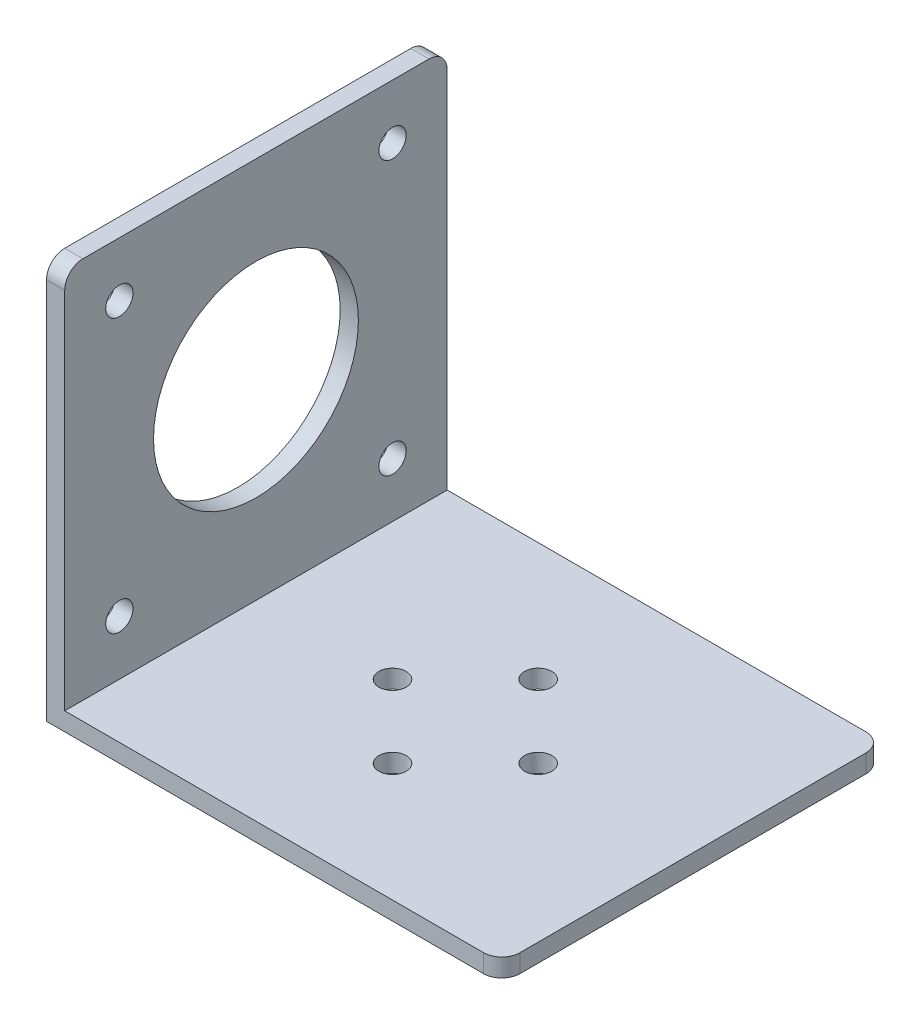
from build123d import *

# Parameters (mm, degrees)
SKETCH_1_W      = 50
SKETCH_1_H      = 42
SKETCH_1_R      = 1.5
EXTRUDE_2_DEPTH = 2
SKETCH_2_W      = 42
SKETCH_2_H      = 42
SKETCH_2_R      = 1.5
SKETCH_2_R_2    = 11.25
EXTRUDE_3_DEPTH = 2
FILLET_1_R      = 2
FILLET_2_R      = 2
FILLET_3_R      = 2


with BuildPart() as part:
    # 草图1 → 凸台-拉伸2 (new body)
    with BuildSketch(Plane(origin=(0, 0, 0), x_dir=(1, 0, 0), z_dir=(0, 1, 0))):
        Rectangle(SKETCH_1_W, SKETCH_1_H)
        with Locations((8, 0)):
            Circle(SKETCH_1_R, mode=Mode.SUBTRACT)
        with Locations((0, 8)):
            Circle(SKETCH_1_R, mode=Mode.SUBTRACT)
        with Locations((-8, 0)):
            Circle(SKETCH_1_R, mode=Mode.SUBTRACT)
        with Locations((0, -8)):
            Circle(SKETCH_1_R, mode=Mode.SUBTRACT)
    extrude(amount=EXTRUDE_2_DEPTH)

    # 草图2 → 凸台-拉伸3 (add)
    with BuildSketch(Plane.ZY.offset(25)):
        with Locations((0, 23)):
            Rectangle(SKETCH_2_W, SKETCH_2_H)
        with Locations((15, 38)):
            Circle(SKETCH_2_R, mode=Mode.SUBTRACT)
        with Locations((15, 8)):
            Circle(SKETCH_2_R, mode=Mode.SUBTRACT)
        with Locations((-15, 8)):
            Circle(SKETCH_2_R, mode=Mode.SUBTRACT)
        with Locations((-15, 38)):
            Circle(SKETCH_2_R, mode=Mode.SUBTRACT)
        with Locations((0, 23)):
            Circle(SKETCH_2_R_2, mode=Mode.SUBTRACT)
    extrude(amount=-EXTRUDE_3_DEPTH)

    # 圆角1
    fillet_1_edges = [part.edges().sort_by_distance(p)[0] for p in [
        (-24, 44, 21),
    ]]
    fillet(fillet_1_edges, radius=FILLET_1_R)

    # 圆角2
    fillet_2_edges = [part.edges().sort_by_distance(p)[0] for p in [
        (-24, 44, -21),
    ]]
    fillet(fillet_2_edges, radius=FILLET_2_R)

    # 圆角3
    fillet_3_edges = [part.edges().sort_by_distance(p)[0] for p in [
        (25, 1, -21),
        (25, 1, 21),
    ]]
    fillet(fillet_3_edges, radius=FILLET_3_R)


solid = part.part
